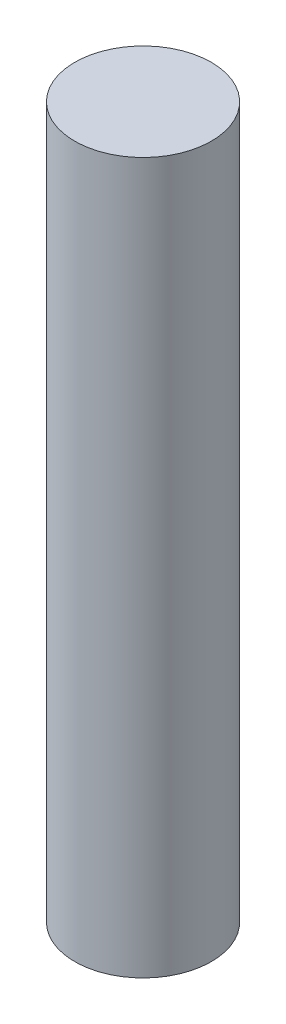
from build123d import *

# Parameters (mm, degrees)
SKETCH1_R           = 10
BOSS_EXTRUDE1_DEPTH = 104


with BuildPart() as part:
    # Sketch1 → Boss-Extrude1 (new body)
    with BuildSketch(Plane(origin=(0, 0, 0), x_dir=(1, 0, 0), z_dir=(0, 1, 0))):
        Circle(SKETCH1_R)
    extrude(amount=BOSS_EXTRUDE1_DEPTH)


solid = part.part
